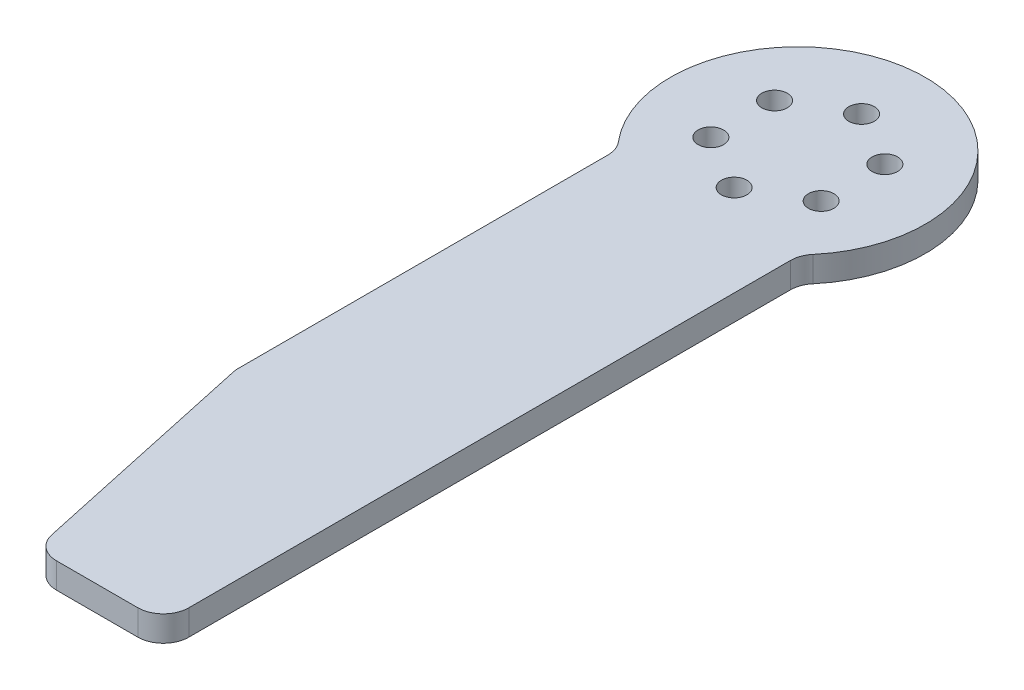
from build123d import *

# Parameters (mm, degrees)
SKETCH1_R           = 1.27
BOSS_EXTRUDE1_DEPTH = 2.54
FILLET1_R           = 2.54


with BuildPart() as part:
    # Sketch1 → Boss-Extrude1 (new body)
    with BuildSketch(Plane(origin=(0, 0, 0), x_dir=(1, 0, 0), z_dir=(0, 1, 0))):
        with BuildLine():
            Line((-9.100749066, -8.858124318), (-9.100749066, -46.958124318))
            Line((-9.100749066, -46.958124318), (-3.599250934, -72.358124318))
            Line((-3.599250934, -72.358124318), (9.100749066, -72.358124318))
            Line((9.100749066, -72.358124318), (9.100749066, -8.858124318))
            ThreePointArc((9.100749066, -8.858124318), (0, 12.7), (-9.100749066, -8.858124318))
        make_face()
        with Locations((0, 6.35)):
            Circle(SKETCH1_R, mode=Mode.SUBTRACT)
        with Locations((5.499261314, 3.175)):
            Circle(SKETCH1_R, mode=Mode.SUBTRACT)
        with Locations((5.499261314, -3.175)):
            Circle(SKETCH1_R, mode=Mode.SUBTRACT)
        with Locations((0, -6.35)):
            Circle(SKETCH1_R, mode=Mode.SUBTRACT)
        with Locations((-5.499261314, -3.175)):
            Circle(SKETCH1_R, mode=Mode.SUBTRACT)
        with Locations((-5.499261314, 3.175)):
            Circle(SKETCH1_R, mode=Mode.SUBTRACT)
    extrude(amount=BOSS_EXTRUDE1_DEPTH)

    # Fillet1
    fillet1_edges = [part.edges().sort_by_distance(p)[0] for p in [
        (-3.599250934, 1.27, 72.358124318),
        (9.100749066, 1.27, 72.358124318),
        (-9.100749066, 1.27, 46.958124318),
        (-9.100749066, 1.27, 8.858124318),
        (9.100749066, 1.27, 8.858124318),
    ]]
    fillet(fillet1_edges, radius=FILLET1_R)


solid = part.part
